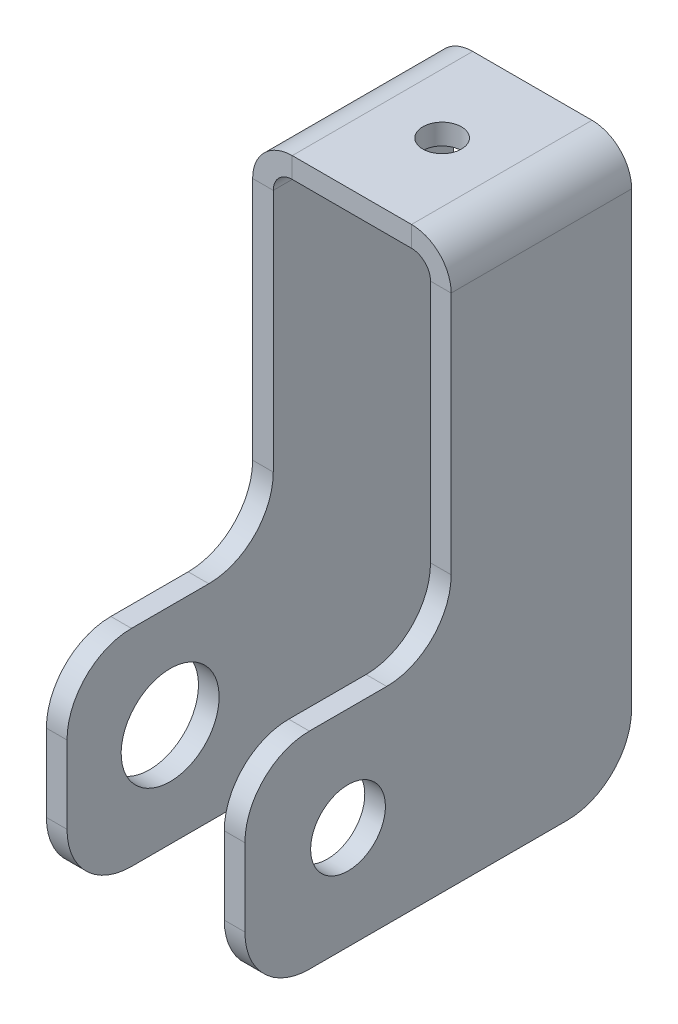
from build123d import *

# Parameters (mm, degrees)
SKETCH1_W                    = 7.7
SKETCH1_H                    = 7
BASE_FLANGE1_DEPTH           = 0.8
EDGE_FLANGE2_STRIP_W         = 4.6732
EDGE_FLANGE2_STRIP_H         = 0.8
EDGE_FLANGE2_STRIP_CUT_DEPTH = 7
EDGE_FLANGE2_DEPTH           = 7
EDGE_FLANGE2_FLAT_DEPTH      = 0.8
HOLE1_START                  = -1.85
HOLE1_OUTLINE_R              = 1.45
HOLE1_DEPTH                  = 0.8
HOLE4_START                  = -0.8
HOLE4_OUTLINE_R              = 0.75
HOLE4_DEPTH                  = 0.8
FILLET1_R                    = 2.5
SKETCH24_R                   = 1.9
CUT_EXTRUDE1_DEPTH           = 1


# Read off the part's stored shape, not the designer's step: Hole1, Hole4
# Sheet-metal steps are written as plain solids
with BuildPart() as part:
    # Sketch1 → Base-Flange1 (new body)
    with BuildSketch(Plane(origin=(0, 0, 0), x_dir=(1, 0, 0), z_dir=(0, 1, 0))):
        with Locations((2, -0.01953125)):
            Rectangle(SKETCH1_W, SKETCH1_H)
    extrude(amount=-BASE_FLANGE1_DEPTH)

    # Edge-Flange2 strip (across the edge) → Edge-Flange2 strip cut (cut)
    with BuildSketch(Plane(origin=(-1.85, -0.8, 3.51953125), x_dir=(1, 0, 0), z_dir=(0, 0, -1))):
        with Locations((-0.8, -0.4)):
            Rectangle(EDGE_FLANGE2_STRIP_W, EDGE_FLANGE2_STRIP_H)
    edge_flange2_strip_cut = extrude(amount=EDGE_FLANGE2_STRIP_CUT_DEPTH, mode=Mode.SUBTRACT)

    # Edge-Flange2 bend section (across the edge) → Edge-Flange2 (add)
    with BuildSketch(Plane(origin=(-1.85, -0.8, 3.51953125), x_dir=(1, 0, 0), z_dir=(0, 0, -1))):
        with BuildLine():
            Line((0, 0.7366), (0.8, 0.7366))
            ThreePointArc((0.8, 0.7366), (1.015745145, 0.215745145), (1.5366, 0))
            Line((1.5366, 0), (1.5366, -0.8))
            ThreePointArc((1.5366, -0.8), (0.45005972, -0.34994028), (0, 0.7366))
        make_face()
    edge_flange2 = extrude(amount=EDGE_FLANGE2_DEPTH)

    # Edge-Flange2 profile (on flange) → Edge-Flange2 flat (add)
    with BuildSketch(Plane(origin=(-1.85, -0.8, 0), x_dir=(0, 0, -1), z_dir=(-1, 0, 0))):
        with BuildLine():
            Line((3.48046875, 0.7366), (3.48046875, 20.7))
            Line((3.48046875, 20.7), (-3.51953125, 20.7))
            Line((-3.51953125, 20.7), (-11.51953125, 20.7))
            Line((-11.51953125, 20.7), (-11.51953125, 12.7))
            Line((-11.51953125, 12.7), (-6.01953125, 12.7))
            ThreePointArc((-6.01953125, 12.7), (-4.251764297, 11.967766953), (-3.51953125, 10.2))
            Line((-3.51953125, 10.2), (-3.51953125, 0.7366))
            Line((-3.51953125, 0.7366), (3.48046875, 0.7366))
        make_face()
    edge_flange2_flat = extrude(amount=-EDGE_FLANGE2_FLAT_DEPTH)

    # Hole1 outline → Hole1 (cut)
    with BuildSketch(Plane.YZ.offset(HOLE1_START)):
        with Locations((-17.5, 7.51953125)):
            Circle(HOLE1_OUTLINE_R)
    hole1 = extrude(amount=HOLE1_DEPTH, mode=Mode.SUBTRACT)

    # Hole4 outline → Hole4 (cut)
    with BuildSketch(Plane(origin=(0, 0, 0), x_dir=(1, 0, 0), z_dir=(0, 1, 0)).offset(HOLE4_START)):
        with Locations((2, -0.01953125)):
            Circle(HOLE4_OUTLINE_R)
    extrude(amount=HOLE4_DEPTH, mode=Mode.SUBTRACT)

    # Mirror1: Edge-Flange2 strip cut, Edge-Flange2, Edge-Flange2 flat, Hole1 across plane
    add(edge_flange2_strip_cut.mirror(Plane(origin=(2, 0, 0), x_dir=(0, 0, 1), z_dir=(1, 0, 0))), mode=Mode.SUBTRACT)
    add(edge_flange2.mirror(Plane(origin=(2, 0, 0), x_dir=(0, 0, 1), z_dir=(1, 0, 0))))
    add(edge_flange2_flat.mirror(Plane(origin=(2, 0, 0), x_dir=(0, 0, 1), z_dir=(1, 0, 0))))
    add(hole1.mirror(Plane(origin=(2, 0, 0), x_dir=(0, 0, 1), z_dir=(1, 0, 0))), mode=Mode.SUBTRACT)

    # Fillet1
    fillet1_edges = [part.edges().sort_by_distance(p)[0] for p in [
        (-1.45, -21.5, -3.48046875),
        (-1.45, -21.5, 11.51953125),
        (-1.45, -13.5, 11.51953125),
        (5.45, -21.5, -3.48046875),
        (5.45, -13.5, 11.51953125),
        (5.45, -21.5, 11.51953125),
    ]]
    fillet(fillet1_edges, radius=FILLET1_R)

    # Sketch24 → Cut-Extrude1 (cut)
    with BuildSketch(Plane(origin=(-1.85, 0, 0), x_dir=(0, 0, -1), z_dir=(1, 0, 0))):
        with Locations(Location((-7.51953125, -17.5, 0), (0, 0, 270))):
            Circle(SKETCH24_R)
    extrude(amount=CUT_EXTRUDE1_DEPTH, mode=Mode.SUBTRACT)


solid = part.part
